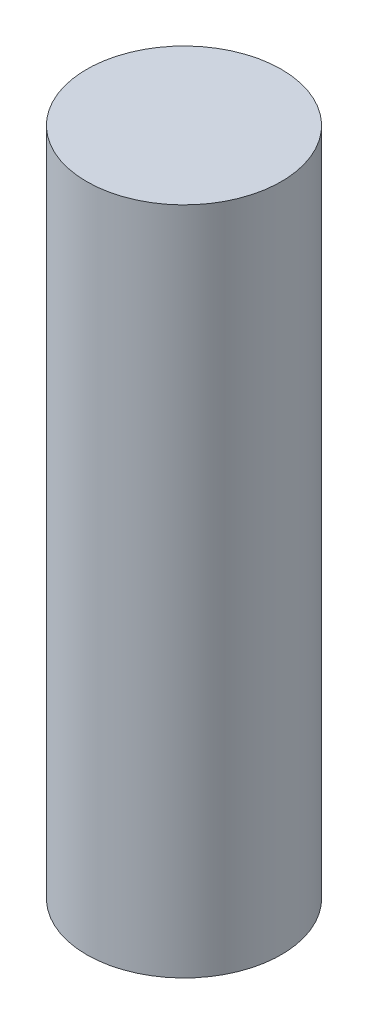
from build123d import *

# Parameters (mm, degrees)
SKETCH1_R           = 12.5
BOSS_EXTRUDE1_DEPTH = 86


with BuildPart() as part:
    # Sketch1 → Boss-Extrude1 (new body)
    with BuildSketch(Plane(origin=(0, 0, 0), x_dir=(1, 0, 0), z_dir=(0, 1, 0))):
        Circle(SKETCH1_R)
    extrude(amount=BOSS_EXTRUDE1_DEPTH)


solid = part.part
